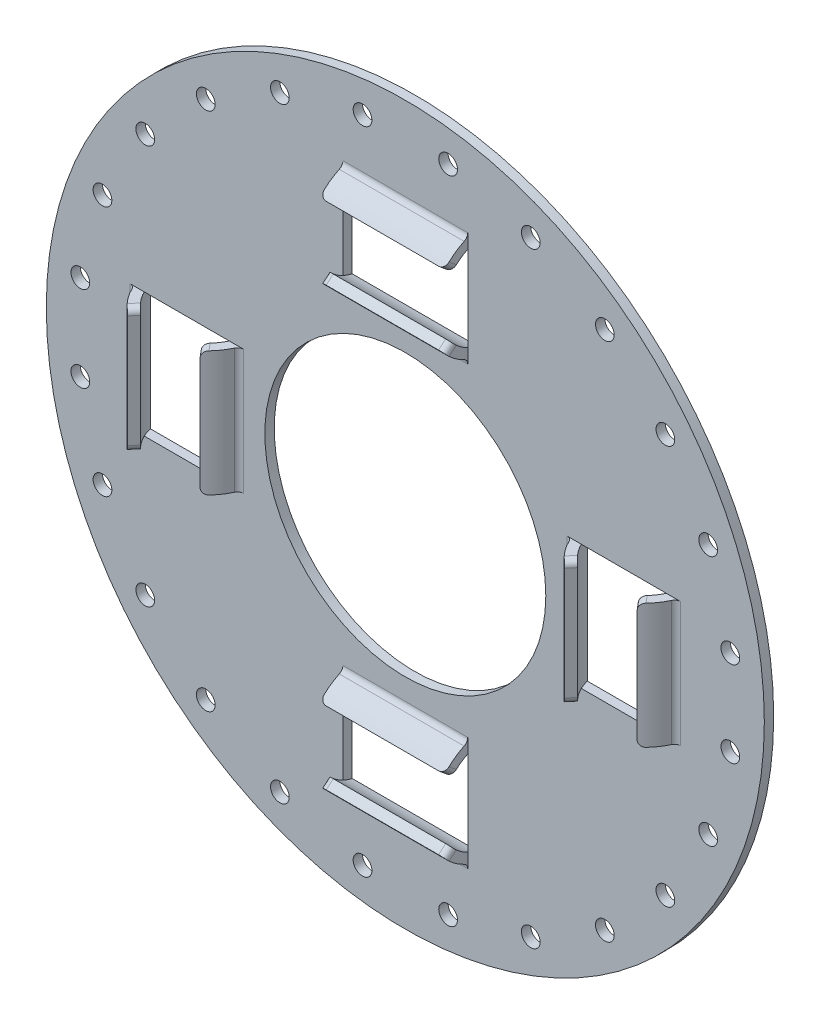
from build123d import *
from OCP.BRepAlgoAPI import BRepAlgoAPI_Cut
from OCP.TopTools import TopTools_ListOfShape

# Parameters (mm, degrees)
SKETCH1_R                   = 57.5
SKETCH1_R_2                 = 22.5
PLATE_DEPTH                 = 1.5
SKETCH2_R                   = 1.5
OUTER_RIVET_HOLES_DEPTH     = 82.331113358
CIRPATTERN1_COUNT           = 24
SKETCH3_W                   = 20
SKETCH3_H                   = 15.1
SPRING_CUT_OUT_DEPTH        = 82.331113358
CUT_OUT_CIRPATTERN_COUNT    = 4
SPRING_RETAINER_DEPTH       = 20
SPRING_RETAINER_2_DEPTH     = 20
RETAINER_START              = -10
RETAINER_CIRPATTERN_DEPTH   = 20
RETAINER_CIRPATTERN_2_DEPTH = 20
FILLET1_R                   = 1
FILLET_START                = -16.968101369
FILLET_CIRPATTERN_DEPTH     = 47.968101369
FILLET_START_2              = -31
FILLET_CIRPATTERN_2_DEPTH   = 2.972968691
FILLET_CIRPATTERN_3_DEPTH   = 47.968101369
FILLET_CIRPATTERN_4_DEPTH   = 2.968101369
FILLET2_R                   = 1
SKETCH6_R                   = 2.5
SPACE_BOSS_DEPTH            = 3.5
FILLET4_R                   = 1
CIRPATTERN2_COUNT           = 4
FILLET4_OF_CIRPATTERN2_R    = 1


with BuildPart() as part:
    # Sketch1 → Plate (new body)
    with BuildSketch(Plane.XY):
        Circle(SKETCH1_R)
        Circle(SKETCH1_R_2, mode=Mode.SUBTRACT)
    extrude(amount=PLATE_DEPTH)

    # Sketch2 → Outer Rivet Holes (cut, through all)
    with BuildSketch(Plane.XY.offset(1.5)):
        with Locations((-6.852625092, 52.050855222)):
            Circle(SKETCH2_R)
    outer_rivet_holes = extrude(amount=-OUTER_RIVET_HOLES_DEPTH, mode=Mode.SUBTRACT)

    # CirPattern1: Outer Rivet Holes ×24 about axis
    cirpattern1_axis = Axis((0, 0, 0), (0, 0, 1))
    for i in range(1, CIRPATTERN1_COUNT):
        add(outer_rivet_holes.rotate(cirpattern1_axis, i * 360 / CIRPATTERN1_COUNT), mode=Mode.SUBTRACT)

    # Sketch3 → Spring Cut Out (cut, through all)
    with BuildSketch(Plane.XY.offset(1.5)):
        with Locations((0, 35)):
            Rectangle(SKETCH3_W, SKETCH3_H)
    spring_cut_out = extrude(amount=-SPRING_CUT_OUT_DEPTH, mode=Mode.SUBTRACT)

    # Cut Out CirPattern: Spring Cut Out ×4 about axis
    cut_out_cirpattern_axis = Axis((0, 0, 0), (0, 0, 1))
    for i in range(1, CUT_OUT_CIRPATTERN_COUNT):
        add(spring_cut_out.rotate(cut_out_cirpattern_axis, i * 360 / CUT_OUT_CIRPATTERN_COUNT), mode=Mode.SUBTRACT)

    # Retainer CirPattern: read off the stored shape, not the designer's step
    # Retainer CirPattern outline → Retainer CirPattern (add)
    with BuildSketch(Plane(origin=(0, 0, 0), x_dir=(1, 0, 0), z_dir=(0, 1, 0)).offset(RETAINER_START)):
        with BuildLine():
            Line((-27.45, 0), (-27.655614389, 0))
            ThreePointArc((-27.655614389, 0), (-28.576458051, -2.217443615), (-30.146953547, -4.033635546))
            Line((-30.146953547, -4.033635546), (-29.182772132, -5.18270221))
            ThreePointArc((-29.182772132, -5.18270221), (-27.63436102, -3.508313647), (-26.553699034, -1.5))
            Line((-26.553699034, -1.5), (-27.45, -1.5))
            Line((-27.45, -1.5), (-27.45, 0))
        make_face()
        with BuildLine():
            Line((-42.344385611, 0), (-42.55, 0))
            Line((-42.55, 0), (-42.55, -1.5))
            Line((-42.55, -1.5), (-43.446300966, -1.5))
            ThreePointArc((-43.446300966, -1.5), (-42.36563898, -3.508313647), (-40.817227868, -5.18270221))
            Line((-40.817227868, -5.18270221), (-39.853046453, -4.033635546))
            ThreePointArc((-39.853046453, -4.033635546), (-41.423541949, -2.217443615), (-42.344385611, 0))
        make_face()
        with BuildLine():
            Line((27.655614389, 0), (27.45, 0))
            Line((27.45, 0), (27.45, -1.5))
            Line((27.45, -1.5), (26.553699034, -1.5))
            ThreePointArc((26.553699034, -1.5), (27.63436102, -3.508313647), (29.182772132, -5.18270221))
            Line((29.182772132, -5.18270221), (30.146953547, -4.033635546))
            ThreePointArc((30.146953547, -4.033635546), (28.576458051, -2.217443615), (27.655614389, 0))
        make_face()
        with BuildLine():
            Line((42.55, 0), (42.344385611, 0))
            ThreePointArc((42.344385611, 0), (41.423541949, -2.217443615), (39.853046453, -4.033635546))
            Line((39.853046453, -4.033635546), (40.817227868, -5.18270221))
            ThreePointArc((40.817227868, -5.18270221), (42.36563898, -3.508313647), (43.446300966, -1.5))
            Line((43.446300966, -1.5), (42.55, -1.5))
            Line((42.55, -1.5), (42.55, 0))
        make_face()
    extrude(amount=RETAINER_CIRPATTERN_DEPTH)

    # Retainer CirPattern 2 outline → Retainer CirPattern 2 (add)
    with BuildSketch(Plane.YZ.offset(RETAINER_START)):
        with BuildLine():
            Line((-27.655614389, 0), (-27.45, 0))
            Line((-27.45, 0), (-27.45, 1.5))
            Line((-27.45, 1.5), (-26.553699034, 1.5))
            ThreePointArc((-26.553699034, 1.5), (-27.63436102, 3.508313647), (-29.182772132, 5.18270221))
            Line((-29.182772132, 5.18270221), (-30.146953547, 4.033635546))
            ThreePointArc((-30.146953547, 4.033635546), (-28.576458051, 2.217443615), (-27.655614389, 0))
        make_face()
        with BuildLine():
            Line((-42.55, 0), (-42.344385611, 0))
            ThreePointArc((-42.344385611, 0), (-41.423541949, 2.217443615), (-39.853046453, 4.033635546))
            Line((-39.853046453, 4.033635546), (-40.817227868, 5.18270221))
            ThreePointArc((-40.817227868, 5.18270221), (-42.36563898, 3.508313647), (-43.446300966, 1.5))
            Line((-43.446300966, 1.5), (-42.55, 1.5))
            Line((-42.55, 1.5), (-42.55, 0))
        make_face()
    extrude(amount=RETAINER_CIRPATTERN_2_DEPTH)


with BuildPart() as body_2:
    # Sketch4 → Spring Retainer (new body)
    with BuildSketch(Plane(origin=(-10, 0, 0), x_dir=(0, 0, -1), z_dir=(1, 0, 0))):
        with BuildLine():
            Line((0, 43.879189152), (0, 42.344385611))
            ThreePointArc((0, 42.344385611), (-2.217443614, 41.423541949), (-4.033635546, 39.853046453))
            Line((-4.033635546, 39.853046453), (-5.18270221, 40.817227868))
            ThreePointArc((-5.18270221, 40.817227868), (-2.853393438, 42.791743634), (0, 43.879189152))
        make_face()
    extrude(amount=SPRING_RETAINER_DEPTH)


with BuildPart() as body_3:
    # Sketch4 → Spring Retainer 2 (new body)
    with BuildSketch(Plane(origin=(-10, 0, 0), x_dir=(0, 0, -1), z_dir=(1, 0, 0))):
        with BuildLine():
            Line((-4.033635546, 30.146953547), (-5.18270221, 29.182772132))
            ThreePointArc((-5.18270221, 29.182772132), (-2.853393438, 27.208256366), (0, 26.120810848))
            Line((0, 26.120810848), (0, 27.655614389))
            ThreePointArc((0, 27.655614389), (-2.217443614, 28.576458051), (-4.033635546, 30.146953547))
        make_face()
    extrude(amount=SPRING_RETAINER_2_DEPTH)


with BuildPart() as part_1:
    add(part.part)

    # Combine1: union body 3, body 2
    add(body_3.part)
    add(body_2.part)

    # Fillet1
    fillet1_edges = [part_1.edges().sort_by_distance(p)[0] for p in [
        (-10, 29.66486284, 4.608168878),
        (10, 29.66486284, 4.608168878),
        (-10, 40.33513716, 4.608168878),
        (10, 40.33513716, 4.608168878),
    ]]
    fillet(fillet1_edges, radius=FILLET1_R)


with BuildPart() as fillet_cirpattern_tool:
    # Fillet CirPattern: read off the stored shape, not the designer's step
    # Fillet CirPattern outline → Fillet CirPattern (new body)
    with BuildSketch(Plane(origin=(0, 0, 0), x_dir=(0.7660444431189717, 0, -0.6427876096865469), z_dir=(0.6427876096865469, 0, 0.7660444431189718)).offset(FILLET_START)):
        with BuildLine():
            Line((27.936433826, 10), (27.936433826, 9))
            ThreePointArc((27.936433826, 9), (28.229327045, 9.707106781), (28.936433826, 10))
            Line((28.936433826, 10), (27.936433826, 10))
        make_face()
        with BuildLine():
            ThreePointArc((28.936433826, -10), (28.229327045, -9.707106781), (27.936433826, -9))
            Line((27.936433826, -9), (27.936433826, -10))
            Line((27.936433826, -10), (28.936433826, -10))
        make_face()
        with BuildLine():
            Line((-25.686677192, 10), (-25.686677192, 9))
            ThreePointArc((-25.686677192, 9), (-25.393783973, 9.707106781), (-24.686677192, 10))
            Line((-24.686677192, 10), (-25.686677192, 10))
        make_face()
        with BuildLine():
            ThreePointArc((-24.686677192, -10), (-25.393783973, -9.707106781), (-25.686677192, -9))
            Line((-25.686677192, -9), (-25.686677192, -10))
            Line((-25.686677192, -10), (-24.686677192, -10))
        make_face()
    extrude(amount=FILLET_CIRPATTERN_DEPTH)


with BuildPart() as part_2:
    add(part_1.part)

    # Fillet CirPattern: cut by fillet_cirpattern_tool, with a tolerance
    fillet_cirpattern_stock = TopTools_ListOfShape()
    fillet_cirpattern_stock.Append(part_2.part.wrapped)
    fillet_cirpattern_tools = TopTools_ListOfShape()
    fillet_cirpattern_tools.Append(fillet_cirpattern_tool.part.wrapped)
    fillet_cirpattern_cut = BRepAlgoAPI_Cut()
    fillet_cirpattern_cut.SetArguments(fillet_cirpattern_stock)
    fillet_cirpattern_cut.SetTools(fillet_cirpattern_tools)
    fillet_cirpattern_cut.SetFuzzyValue(0.00001)
    fillet_cirpattern_cut.Build()
    add(Compound.cast(fillet_cirpattern_cut.Shape()).solids(), mode=Mode.REPLACE)


with BuildPart() as fillet_cirpattern_2_tool:
    # Fillet CirPattern 2 outline → Fillet CirPattern 2 (new body)
    with BuildSketch(Plane(origin=(0, 0, 0), x_dir=(1, 0, 0), z_dir=(0, 0.6427876096865469, -0.7660444431189718)).offset(FILLET_START_2)):
        with BuildLine():
            Line((-10, 27.936433826), (-9, 27.936433826))
            ThreePointArc((-9, 27.936433826), (-9.707106781, 28.229327045), (-10, 28.936433826))
            Line((-10, 28.936433826), (-10, 27.936433826))
        make_face()
        with BuildLine():
            ThreePointArc((10, 28.936433826), (9.707106781, 28.229327045), (9, 27.936433826))
            Line((9, 27.936433826), (10, 27.936433826))
            Line((10, 27.936433826), (10, 28.936433826))
        make_face()
    extrude(amount=FILLET_CIRPATTERN_2_DEPTH)


with BuildPart() as part_3:
    add(part_2.part)

    # Fillet CirPattern 2: cut by fillet_cirpattern_2_tool, with a tolerance
    fillet_cirpattern_2_stock = TopTools_ListOfShape()
    fillet_cirpattern_2_stock.Append(part_3.part.wrapped)
    fillet_cirpattern_2_tools = TopTools_ListOfShape()
    fillet_cirpattern_2_tools.Append(fillet_cirpattern_2_tool.part.wrapped)
    fillet_cirpattern_2_cut = BRepAlgoAPI_Cut()
    fillet_cirpattern_2_cut.SetArguments(fillet_cirpattern_2_stock)
    fillet_cirpattern_2_cut.SetTools(fillet_cirpattern_2_tools)
    fillet_cirpattern_2_cut.SetFuzzyValue(0.00001)
    fillet_cirpattern_2_cut.Build()
    add(Compound.cast(fillet_cirpattern_2_cut.Shape()).solids(), mode=Mode.REPLACE)


with BuildPart() as fillet_cirpattern_3_tool:
    # Fillet CirPattern 3 outline → Fillet CirPattern 3 (new body)
    with BuildSketch(Plane(origin=(0, 0, 0), x_dir=(0.7660444431189717, 0, 0.6427876096865469), z_dir=(0.6427876096865469, 0, -0.7660444431189718)).offset(FILLET_START_2)):
        with BuildLine():
            Line((-27.936433826, -10), (-27.936433826, -9))
            ThreePointArc((-27.936433826, -9), (-28.229327045, -9.707106781), (-28.936433826, -10))
            Line((-28.936433826, -10), (-27.936433826, -10))
        make_face()
        with BuildLine():
            ThreePointArc((-28.936433826, 10), (-28.229327045, 9.707106781), (-27.936433826, 9))
            Line((-27.936433826, 9), (-27.936433826, 10))
            Line((-27.936433826, 10), (-28.936433826, 10))
        make_face()
        with BuildLine():
            Line((25.686677192, -10), (25.686677192, -9))
            ThreePointArc((25.686677192, -9), (25.393783973, -9.707106781), (24.686677192, -10))
            Line((24.686677192, -10), (25.686677192, -10))
        make_face()
        with BuildLine():
            ThreePointArc((24.686677192, 10), (25.393783973, 9.707106781), (25.686677192, 9))
            Line((25.686677192, 9), (25.686677192, 10))
            Line((25.686677192, 10), (24.686677192, 10))
        make_face()
    extrude(amount=FILLET_CIRPATTERN_3_DEPTH)


with BuildPart() as part_4:
    add(part_3.part)

    # Fillet CirPattern 3: cut by fillet_cirpattern_3_tool, with a tolerance
    fillet_cirpattern_3_stock = TopTools_ListOfShape()
    fillet_cirpattern_3_stock.Append(part_4.part.wrapped)
    fillet_cirpattern_3_tools = TopTools_ListOfShape()
    fillet_cirpattern_3_tools.Append(fillet_cirpattern_3_tool.part.wrapped)
    fillet_cirpattern_3_cut = BRepAlgoAPI_Cut()
    fillet_cirpattern_3_cut.SetArguments(fillet_cirpattern_3_stock)
    fillet_cirpattern_3_cut.SetTools(fillet_cirpattern_3_tools)
    fillet_cirpattern_3_cut.SetFuzzyValue(0.00001)
    fillet_cirpattern_3_cut.Build()
    add(Compound.cast(fillet_cirpattern_3_cut.Shape()).solids(), mode=Mode.REPLACE)


with BuildPart() as fillet_cirpattern_4_tool:
    # Fillet CirPattern 4 outline → Fillet CirPattern 4 (new body)
    with BuildSketch(Plane(origin=(0, 0, 0), x_dir=(1, 0, 0), z_dir=(0, 0.6427876096865381, 0.7660444431189791)).offset(FILLET_START)):
        with BuildLine():
            Line((-10, -25.686677192), (-9, -25.686677192))
            ThreePointArc((-9, -25.686677192), (-9.707106781, -25.393783973), (-10, -24.686677192))
            Line((-10, -24.686677192), (-10, -25.686677192))
        make_face()
        with BuildLine():
            ThreePointArc((10, -24.686677192), (9.707106781, -25.393783973), (9, -25.686677192))
            Line((9, -25.686677192), (10, -25.686677192))
            Line((10, -25.686677192), (10, -24.686677192))
        make_face()
    extrude(amount=FILLET_CIRPATTERN_4_DEPTH)


with BuildPart() as part_5:
    add(part_4.part)

    # Fillet CirPattern 4: cut by fillet_cirpattern_4_tool, with a tolerance
    fillet_cirpattern_4_stock = TopTools_ListOfShape()
    fillet_cirpattern_4_stock.Append(part_5.part.wrapped)
    fillet_cirpattern_4_tools = TopTools_ListOfShape()
    fillet_cirpattern_4_tools.Append(fillet_cirpattern_4_tool.part.wrapped)
    fillet_cirpattern_4_cut = BRepAlgoAPI_Cut()
    fillet_cirpattern_4_cut.SetArguments(fillet_cirpattern_4_stock)
    fillet_cirpattern_4_cut.SetTools(fillet_cirpattern_4_tools)
    fillet_cirpattern_4_cut.SetFuzzyValue(0.00001)
    fillet_cirpattern_4_cut.Build()
    add(Compound.cast(fillet_cirpattern_4_cut.Shape()).solids(), mode=Mode.REPLACE)

    # Fillet2
    fillet2_edges = [part_5.edges().sort_by_distance(p)[0] for p in [
        (-26.553699034, 0, 1.5),
        (0, -26.553699034, 1.5),
        (26.553699034, 0, 1.5),
        (-43.446300966, 0, 1.5),
        (0, -43.446300966, 1.5),
        (43.446300966, 0, 1.5),
        (0, 26.553699034, 1.5),
        (0, 43.446300966, 1.5),
    ]]
    fillet(fillet2_edges, radius=FILLET2_R)

    # Sketch6 → Space Boss (add)
    with BuildSketch(Plane(origin=(0, 0, 0), x_dir=(-1, 0, 0), z_dir=(0, 0, -1))):
        with Locations(Location((27.400387771, 27.400387771, 0), (0, 0, 180))):
            Circle(SKETCH6_R)
    space_boss = extrude(amount=SPACE_BOSS_DEPTH)

    # Fillet4
    fillet4_edges = [part_5.edges().sort_by_distance(p)[0] for p in [
        (-29.900387771, 27.400387771, 0),
    ]]
    fillet(fillet4_edges, radius=FILLET4_R)

    # CirPattern2: Space Boss ×4 about axis
    cirpattern2_axis = Axis((0, 0, 0), (0, 0, 1))
    for i in range(1, CIRPATTERN2_COUNT):
        add(space_boss.rotate(cirpattern2_axis, i * 360 / CIRPATTERN2_COUNT))

    # Fillet4 of CirPattern2
    fillet4_of_cirpattern2_edges = [part_5.edges().sort_by_distance(p)[0] for p in [
        (-27.400387771, -29.900387771, 0),
        (29.900387771, -27.400387771, 0),
        (27.400387771, 29.900387771, 0),
    ]]
    fillet(fillet4_of_cirpattern2_edges, radius=FILLET4_OF_CIRPATTERN2_R)


solid = part_5.part
